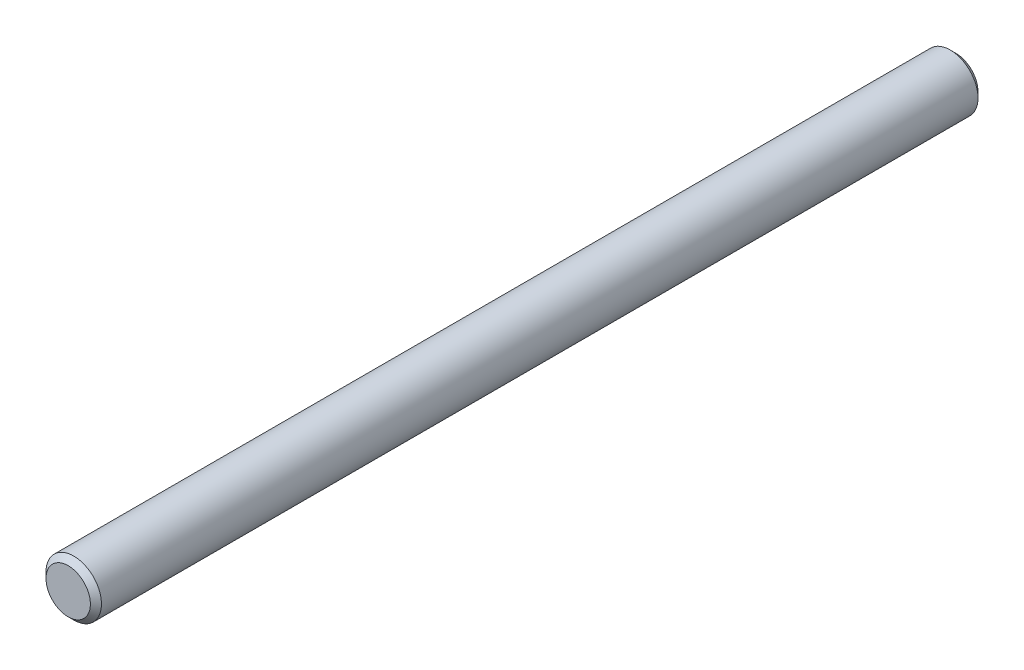
from build123d import *

# Parameters (mm, degrees)
SKETCH1_R      = 9.525
EXTRUDE1_DEPTH = 152.4
CHAMFER1_SIZE  = 1.905


with BuildPart() as part:
    # Sketch1 → Extrude1 (new, symmetric)
    with BuildSketch(Plane.XY):
        Circle(SKETCH1_R)
    extrude(amount=EXTRUDE1_DEPTH, both=True)

    # Chamfer1
    chamfer1_edges = [part.edges().sort_by_distance(p)[0] for p in [
        (-9.525, 0, -152.4),
        (-9.525, 0, 152.4),
    ]]
    chamfer(chamfer1_edges, length=CHAMFER1_SIZE)


solid = part.part
